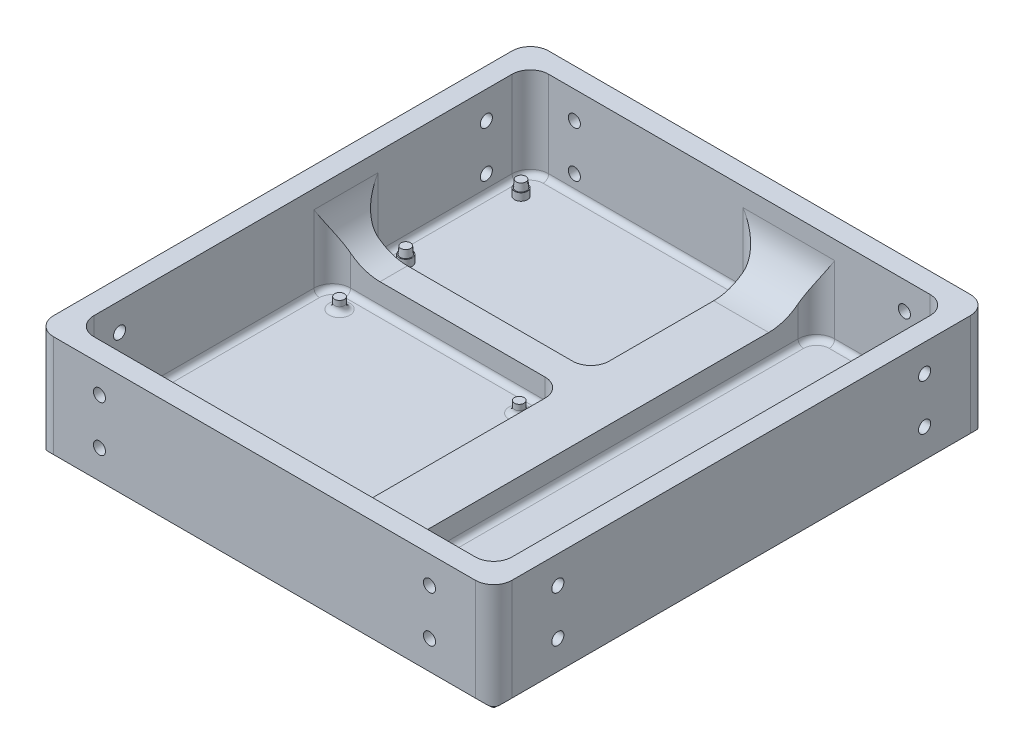
from build123d import *
from OCP.BRepFilletAPI import BRepFilletAPI_MakeChamfer

# Parameters (mm, degrees)
SKETCH1_W                      = 130
SKETCH1_H                      = 140
BOSS_EXTRUDE2_DEPTH            = 10
SKETCH3_R                      = 1.3
BOSS_EXTRUDE4_DEPTH            = 2
SKETCH4_R                      = 1.15
BOSS_EXTRUDE5_DEPTH            = 3
BOSS_EXTRUDE5_DRAFT            = -5
BOSS_EXTRUDE5_PROFILE_2_DEPTH  = 3
BOSS_EXTRUDE5_PROFILE_2_DRAFT  = -5
BOSS_EXTRUDE5_PROFILE_3_DEPTH  = 3
BOSS_EXTRUDE5_PROFILE_3_DRAFT  = -5
BOSS_EXTRUDE5_PROFILE_4_DEPTH  = 3
BOSS_EXTRUDE5_PROFILE_4_DRAFT  = -5
CHAMFER1_SIZE                  = 1.5
CHAMFER1_SIZE2                 = 1.38459352
SKETCH5_W                      = 110
SKETCH5_H                      = 120
BOSS_EXTRUDE6_DEPTH            = 20
SKETCH7_W                      = 114
SKETCH7_H                      = 124
SKETCH7_W_2                    = 110
SKETCH7_H_2                    = 120
CUT_EXTRUDE2_DEPTH             = 20
SKETCH9_W                      = 15
SKETCH9_H                      = 124
BOSS_EXTRUDE8_DEPTH            = 5
SKETCH10_W                     = 63
SKETCH10_H                     = 7.5
BOSS_EXTRUDE9_DEPTH            = 5
SKETCH12_W                     = 63
SKETCH12_H                     = 46.5
SKETCH12_W_2                   = 36
SKETCH12_H_2                   = 124
SKETCH12_H_3                   = 70
SKETCH12_R                     = 1.327872471
SKETCH12_R_2                   = 1.253859906
CUT_EXTRUDE6_DEPTH             = 5
SKETCH14_W                     = 59.963590068
SKETCH14_H                     = 68.475850711
CUT_EXTRUDE9_DEPTH             = 7
SKETCH16_W                     = 114
SKETCH16_H                     = 124
CUT_EXTRUDE10_DEPTH            = 3
FILLET12_R                     = 13
FILLET13_R                     = 5
FILLET14_R                     = 5
FILLET15_R                     = 1.5
SKETCH24_R                     = 1.65
CUT_EXTRUDE16_DEPTH            = 10
CUT_EXTRUDE17_START            = -10
SKETCH25_R                     = 1.65
CUT_EXTRUDE17_DEPTH            = 10
SKETCH26_R                     = 1.65
CUT_EXTRUDE18_DEPTH            = 10
CUT_EXTRUDE19_START            = -10
SKETCH27_R                     = 1.65
CUT_EXTRUDE19_DEPTH            = 10
FILLET17_SIZE                  = 5
SKETCH30_R                     = 1.75
BOSS_EXTRUDE10_DEPTH           = 2
SKETCH31_R                     = 1.5
BOSS_EXTRUDE11_DEPTH           = 2
BOSS_EXTRUDE11_DRAFT           = 5
BOSS_EXTRUDE11_PROFILE_2_DEPTH = 2
BOSS_EXTRUDE11_PROFILE_2_DRAFT = 5
SKETCH32_W                     = 130
SKETCH32_H                     = 140
SKETCH32_W_2                   = 125
SKETCH32_H_2                   = 135
CUT_EXTRUDE22_DEPTH            = 50
FILLET18_R                     = 5


with BuildPart() as part:
    # Sketch1 → Boss-Extrude2 (new body)
    with BuildSketch(Plane(origin=(0, 0, 0), x_dir=(1, 0, 0), z_dir=(0, 1, 0))):
        with Locations((-18.656773153, -29.741986999)):
            Rectangle(SKETCH1_W, SKETCH1_H)
    extrude(amount=BOSS_EXTRUDE2_DEPTH)

    # Sketch3 → Boss-Extrude4 (add)
    with BuildSketch(Plane(origin=(0, 10, 0), x_dir=(1, 0, 0), z_dir=(0, 1, 0))):
        with Locations(Location((-68.656773153, -26.741986999, 0), (0, 0, 270))):
            Circle(SKETCH3_R)
        with Locations(Location((-19.656773153, -26.741986999, 0), (0, 0, 270))):
            Circle(SKETCH3_R)
        with Locations(Location((-68.656773153, -84.741986999, 0), (0, 0, 270))):
            Circle(SKETCH3_R)
        with Locations(Location((-19.656773153, -84.741986999, 0), (0, 0, 270))):
            Circle(SKETCH3_R)
    extrude(amount=BOSS_EXTRUDE4_DEPTH)


with BuildPart() as boss_extrude5_tool:
    # Sketch4 → Boss-Extrude5 (with draft: the straight prism first)
    with BuildSketch(Plane(origin=(0, 12, 0), x_dir=(1, 0, 0), z_dir=(0, 1, 0))):
        with Locations((-68.656773153, -26.741986999)):
            Circle(SKETCH4_R)
    extrude(amount=BOSS_EXTRUDE5_DEPTH)
    # Boss-Extrude5: the draft: its side faces are tilted about the plane it starts from
    boss_extrude5_sides = [boss_extrude5_tool.faces().sort_by_distance(p)[0] for p in [
        (-69.806773153, 13.5, 26.741986999),
    ]]
    draft(boss_extrude5_sides, Plane(origin=(0, 12, 0), x_dir=(1, 0, 0), z_dir=(0, 1, 0)), BOSS_EXTRUDE5_DRAFT)


with BuildPart() as part_1:
    add(part.part)

    # Boss-Extrude5: add boss_extrude5_tool
    add(boss_extrude5_tool.part)


with BuildPart() as boss_extrude5_profile_2_tool:
    # Sketch4 → Boss-Extrude5 profile 2 (with draft: the straight prism first)
    with BuildSketch(Plane(origin=(0, 12, 0), x_dir=(1, 0, 0), z_dir=(0, 1, 0))):
        with Locations((-68.656773153, -84.741986999)):
            Circle(SKETCH4_R)
    extrude(amount=BOSS_EXTRUDE5_PROFILE_2_DEPTH)
    # Boss-Extrude5 profile 2: the draft: its side faces are tilted about the plane it starts from
    boss_extrude5_profile_2_sides = [boss_extrude5_profile_2_tool.faces().sort_by_distance(p)[0] for p in [
        (-69.806773153, 13.5, 84.741986999),
    ]]
    draft(boss_extrude5_profile_2_sides, Plane(origin=(0, 12, 0), x_dir=(1, 0, 0), z_dir=(0, 1, 0)), BOSS_EXTRUDE5_PROFILE_2_DRAFT)


with BuildPart() as part_2:
    add(part_1.part)

    # Boss-Extrude5 profile 2: add boss_extrude5_profile_2_tool
    add(boss_extrude5_profile_2_tool.part)


with BuildPart() as boss_extrude5_profile_3_tool:
    # Sketch4 → Boss-Extrude5 profile 3 (with draft: the straight prism first)
    with BuildSketch(Plane(origin=(0, 12, 0), x_dir=(1, 0, 0), z_dir=(0, 1, 0))):
        with Locations((-19.656773153, -84.741986999)):
            Circle(SKETCH4_R)
    extrude(amount=BOSS_EXTRUDE5_PROFILE_3_DEPTH)
    # Boss-Extrude5 profile 3: the draft: its side faces are tilted about the plane it starts from
    boss_extrude5_profile_3_sides = [boss_extrude5_profile_3_tool.faces().sort_by_distance(p)[0] for p in [
        (-20.806773153, 13.5, 84.741986999),
    ]]
    draft(boss_extrude5_profile_3_sides, Plane(origin=(0, 12, 0), x_dir=(1, 0, 0), z_dir=(0, 1, 0)), BOSS_EXTRUDE5_PROFILE_3_DRAFT)


with BuildPart() as part_3:
    add(part_2.part)

    # Boss-Extrude5 profile 3: add boss_extrude5_profile_3_tool
    add(boss_extrude5_profile_3_tool.part)


with BuildPart() as boss_extrude5_profile_4_tool:
    # Sketch4 → Boss-Extrude5 profile 4 (with draft: the straight prism first)
    with BuildSketch(Plane(origin=(0, 12, 0), x_dir=(1, 0, 0), z_dir=(0, 1, 0))):
        with Locations((-19.656773153, -26.741986999)):
            Circle(SKETCH4_R)
    extrude(amount=BOSS_EXTRUDE5_PROFILE_4_DEPTH)
    # Boss-Extrude5 profile 4: the draft: its side faces are tilted about the plane it starts from
    boss_extrude5_profile_4_sides = [boss_extrude5_profile_4_tool.faces().sort_by_distance(p)[0] for p in [
        (-20.806773153, 13.5, 26.741986999),
    ]]
    draft(boss_extrude5_profile_4_sides, Plane(origin=(0, 12, 0), x_dir=(1, 0, 0), z_dir=(0, 1, 0)), BOSS_EXTRUDE5_PROFILE_4_DRAFT)


with BuildPart() as part_4:
    add(part_3.part)

    # Boss-Extrude5 profile 4: add boss_extrude5_profile_4_tool
    add(boss_extrude5_profile_4_tool.part)

    # Chamfer1: one chamfer whose edges measure the first distance from different faces: ONE call of the kernel's chamfer builder (chamfer() names one face for all edges)
    chamfer1_edges_1 = [part_4.edges().sort_by_distance(p)[0] for p in [
        (-70.069239144, 15, 26.741986999),
    ]]
    chamfer1_side_1 = [part_4.faces().sort_by_distance(p)[0] for p in [
        (-69.938006148, 13.5, 26.741986999),
    ]]
    chamfer1_edges_2 = [part_4.edges().sort_by_distance(p)[0] for p in [
        (-70.069239144, 15, 84.741986999),
    ]]
    chamfer1_side_2 = [part_4.faces().sort_by_distance(p)[0] for p in [
        (-69.938006148, 13.5, 84.741986999),
    ]]
    chamfer1_edges_3 = [part_4.edges().sort_by_distance(p)[0] for p in [
        (-21.069239144, 15, 84.741986999),
    ]]
    chamfer1_side_3 = [part_4.faces().sort_by_distance(p)[0] for p in [
        (-20.938006148, 13.5, 84.741986999),
    ]]
    chamfer1_edges_4 = [part_4.edges().sort_by_distance(p)[0] for p in [
        (-21.069239144, 15, 26.741986999),
    ]]
    chamfer1_side_4 = [part_4.faces().sort_by_distance(p)[0] for p in [
        (-20.938006148, 13.5, 26.741986999),
    ]]
    chamfer1 = BRepFilletAPI_MakeChamfer(part_4.part.solid().wrapped)
    for e in chamfer1_edges_1:
        chamfer1.Add(CHAMFER1_SIZE, CHAMFER1_SIZE2, e.wrapped, chamfer1_side_1[0].wrapped)  # the first distance lies on this face
    for e in chamfer1_edges_2:
        chamfer1.Add(CHAMFER1_SIZE, CHAMFER1_SIZE2, e.wrapped, chamfer1_side_2[0].wrapped)  # the first distance lies on this face
    for e in chamfer1_edges_3:
        chamfer1.Add(CHAMFER1_SIZE, CHAMFER1_SIZE2, e.wrapped, chamfer1_side_3[0].wrapped)  # the first distance lies on this face
    for e in chamfer1_edges_4:
        chamfer1.Add(CHAMFER1_SIZE, CHAMFER1_SIZE2, e.wrapped, chamfer1_side_4[0].wrapped)  # the first distance lies on this face
    add(Compound.cast(chamfer1.Shape()), mode=Mode.REPLACE)

    # Sketch5 → Boss-Extrude6 (add)
    with BuildSketch(Plane(origin=(0, 10, 0), x_dir=(1, 0, 0), z_dir=(0, 1, 0))):
        Polygon((-83.656773153, -89.741986999), (-83.656773153, -99.741986999), (-73.656773153, -99.741986999), (36.343226847, -99.741986999), (46.343226847, -99.741986999), (46.343226847, -89.741986999), (46.343226847, 30.258013001), (46.343226847, 40.258013001), (36.343226847, 40.258013001), (-73.656773153, 40.258013001), (-83.656773153, 40.258013001), (-83.656773153, 30.258013001), align=None)
        with Locations((-18.656773153, -29.741986999)):
            Rectangle(SKETCH5_W, SKETCH5_H, mode=Mode.SUBTRACT)
    extrude(amount=BOSS_EXTRUDE6_DEPTH)

    # Sketch7 → Cut-Extrude2 (cut)
    with BuildSketch(Plane(origin=(0, 30, 0), x_dir=(1, 0, 0), z_dir=(0, 1, 0))):
        with Locations((-18.656773153, -29.741986999)):
            Rectangle(SKETCH7_W, SKETCH7_H)
        with Locations((-18.656773153, -29.741986999)):
            Rectangle(SKETCH7_W_2, SKETCH7_H_2, mode=Mode.SUBTRACT)
    extrude(amount=-CUT_EXTRUDE2_DEPTH, mode=Mode.SUBTRACT)

    # Sketch9 → Boss-Extrude8 (add)
    with BuildSketch(Plane(origin=(0, 10, 0), x_dir=(1, 0, 0), z_dir=(0, 1, 0))):
        with Locations((-5.156773153, -29.741986999)):
            Rectangle(SKETCH9_W, SKETCH9_H)
    extrude(amount=BOSS_EXTRUDE8_DEPTH)

    # Sketch10 → Boss-Extrude9 (add)
    with BuildSketch(Plane(origin=(0, 10, 0), x_dir=(1, 0, 0), z_dir=(0, 1, 0))):
        with Locations((-44.156773153, -17.991986999)):
            Rectangle(SKETCH10_W, SKETCH10_H)
    extrude(amount=BOSS_EXTRUDE9_DEPTH)

    # Sketch12 → Cut-Extrude6 (cut)
    # profile 1 of 3: a face of its own
    with BuildSketch(Plane(origin=(0, 10, 0), x_dir=(1, 0, 0), z_dir=(0, 1, 0))):
        with Locations((-44.156773153, 9.008013001)):
            Rectangle(SKETCH12_W, SKETCH12_H)
    # profile 2 of 3: a face of its own
    with BuildSketch(Plane(origin=(0, 10, 0), x_dir=(1, 0, 0), z_dir=(0, 1, 0))):
        with Locations((20.343226847, -29.741986999)):
            Rectangle(SKETCH12_W_2, SKETCH12_H_2)
    # profile 3 of 3: a face of its own
    with BuildSketch(Plane(origin=(0, 10, 0), x_dir=(1, 0, 0), z_dir=(0, 1, 0))):
        with Locations((-44.156773153, -56.741986999)):
            Rectangle(SKETCH12_W, SKETCH12_H_3)
        with Locations(Location((-68.684645624, -26.741986999, 0), (0, 0, 270))):
            Circle(SKETCH12_R, mode=Mode.SUBTRACT)
        with Locations(Location((-19.656773153, -26.76985947, 0), (0, 0, 270))):
            Circle(SKETCH12_R, mode=Mode.SUBTRACT)
        with Locations(Location((-19.628900682, -84.741986999, 0), (0, 0, 270))):
            Circle(SKETCH12_R_2, mode=Mode.SUBTRACT)
        with Locations(Location((-68.656773153, -84.714114528, 0), (0, 0, 270))):
            Circle(SKETCH12_R_2, mode=Mode.SUBTRACT)
    extrude(amount=-CUT_EXTRUDE6_DEPTH, mode=Mode.SUBTRACT)

    # Sketch14 → Cut-Extrude9 (cut)
    with BuildSketch(Plane(origin=(0, 15, 0), x_dir=(1, 0, 0), z_dir=(0, 1, 0))):
        with Locations((-45.674978119, -55.979912355)):
            Rectangle(SKETCH14_W, SKETCH14_H)
    extrude(amount=-CUT_EXTRUDE9_DEPTH, mode=Mode.SUBTRACT)

    # Sketch16 → Cut-Extrude10 (cut)
    with BuildSketch(Plane(origin=(0, 15, 0), x_dir=(1, 0, 0), z_dir=(0, 1, 0))):
        with Locations((-18.656773153, -29.741986999)):
            Rectangle(SKETCH16_W, SKETCH16_H)
    extrude(amount=-CUT_EXTRUDE10_DEPTH, mode=Mode.SUBTRACT)

    # Fillet12
    fillet12_edges = [part_4.edges().sort_by_distance(p)[0] for p in [
        (-75.656773153, 12, 17.991986999),
        (-5.156773153, 12, -32.258013001),
        (-5.156773153, 12, 91.741986999),
    ]]
    fillet(fillet12_edges, radius=FILLET12_R)

    # Fillet13
    fillet13_edges = [part_4.edges().sort_by_distance(p)[0] for p in [
        (-75.656773153, 15, 21.741986999),
        (-75.656773153, 15, 14.241986999),
        (-12.656773153, 8.5, 21.741986999),
        (-12.656773153, 15, 91.741986999),
        (2.343226847, 15, 91.741986999),
        (2.343226847, 15, -32.258013001),
        (-12.656773153, 8.5, 14.241986999),
        (-12.656773153, 15, -32.258013001),
        (38.343226847, 17.5, 91.741986999),
        (38.343226847, 17.5, -32.258013001),
        (-75.656773153, 17.5, -32.258013001),
        (-75.656773153, 17.5, 91.741986999),
    ]]
    fillet(fillet13_edges, radius=FILLET13_R)

    # Fillet14
    fillet14_edges = [part_4.edges().sort_by_distance(p)[0] for p in [
        (-83.656773153, 15, -40.258013001),
        (46.343226847, 15, -40.258013001),
        (46.343226847, 15, 99.741986999),
        (-83.656773153, 15, 99.741986999),
    ]]
    fillet(fillet14_edges, radius=FILLET14_R)

    # Fillet15
    fillet15_edges = [part_4.edges().sort_by_distance(p)[0] for p in [
        (-68.656773153, 5, 83.460254623),
        (-19.628900682, 5, 83.488127094),
        (-19.656773153, 5, 25.441986999),
        (-68.684645624, 5, 25.414114528),
        (2.343226847, 5, 29.741986999),
        (20.343226847, 5, 91.741986999),
        (38.343226847, 5, 29.741986999),
        (20.343226847, 5, -32.258013001),
        (3.807692941, 5, -30.793546907),
        (36.878760753, 5, 90.277520905),
        (36.878760753, 5, -30.793546907),
        (3.807692941, 5, 90.277520905),
        (-44.156773153, 5, 91.741986999),
        (-44.156773153, 5, 21.741986999),
        (-12.656773153, 5, 56.741986999),
        (-75.656773153, 5, 56.741986999),
        (-14.121239247, 5, 90.277520905),
        (-74.192307059, 5, 90.277520905),
        (-14.121239247, 5, 23.206453093),
        (-74.192307059, 5, 23.206453093),
        (-75.656773153, 5, -9.008013001),
        (-44.156773153, 5, -32.258013001),
        (-44.156773153, 5, 14.241986999),
        (-12.656773153, 5, -9.008013001),
        (-74.192307059, 5, -30.793546907),
        (-14.121239247, 5, -30.793546907),
        (-14.121239247, 5, 12.777520905),
        (-74.192307059, 5, 12.777520905),
    ]]
    fillet(fillet15_edges, radius=FILLET15_R)

    # Sketch24 → Cut-Extrude16 (cut)
    with BuildSketch(Plane(origin=(46.343226847, 0, 0), x_dir=(0, 0, -1), z_dir=(1, 0, 0))):
        with Locations((-79.741986999, 22.5)):
            Circle(SKETCH24_R)
        with Locations((-79.741986999, 10)):
            Circle(SKETCH24_R)
        with Locations((20.258013001, 22.5)):
            Circle(SKETCH24_R)
        with Locations((20.258013001, 10)):
            Circle(SKETCH24_R)
    extrude(amount=-CUT_EXTRUDE16_DEPTH, mode=Mode.SUBTRACT)

    # Sketch25 → Cut-Extrude17 (cut)
    with BuildSketch(Plane.ZY.offset(83.656773153).offset(CUT_EXTRUDE17_START)):
        with Locations(Location((-20.258013001, 22.5, 0), (0, 0, 180))):
            Circle(SKETCH25_R)
        with Locations(Location((-20.258013001, 10, 0), (0, 0, 180))):
            Circle(SKETCH25_R)
        with Locations(Location((79.741986999, 10, 0), (0, 0, 180))):
            Circle(SKETCH25_R)
        with Locations(Location((79.741986999, 22.5, 0), (0, 0, 180))):
            Circle(SKETCH25_R)
    extrude(amount=CUT_EXTRUDE17_DEPTH, mode=Mode.SUBTRACT)

    # Sketch26 → Cut-Extrude18 (cut)
    with BuildSketch(Plane.XY.offset(99.741986999)):
        with Locations((-63.656773153, 22.5)):
            Circle(SKETCH26_R)
        with Locations((-63.656773153, 10)):
            Circle(SKETCH26_R)
        with Locations((26.343226847, 10)):
            Circle(SKETCH26_R)
        with Locations((26.343226847, 22.5)):
            Circle(SKETCH26_R)
    extrude(amount=-CUT_EXTRUDE18_DEPTH, mode=Mode.SUBTRACT)

    # Sketch27 → Cut-Extrude19 (cut)
    with BuildSketch(Plane(origin=(0, 0, -40.258013001), x_dir=(-1, 0, 0), z_dir=(0, 0, -1)).offset(CUT_EXTRUDE19_START)):
        with Locations(Location((-26.343226847, 22.5, 0), (0, 0, 180))):
            Circle(SKETCH27_R)
        with Locations(Location((-26.343226847, 10, 0), (0, 0, 180))):
            Circle(SKETCH27_R)
        with Locations(Location((63.656773153, 22.5, 0), (0, 0, 180))):
            Circle(SKETCH27_R)
        with Locations(Location((63.656773153, 10, 0), (0, 0, 180))):
            Circle(SKETCH27_R)
    extrude(amount=CUT_EXTRUDE19_DEPTH, mode=Mode.SUBTRACT)

    # Fillet17
    # a fillet whose section is not a circle: 5 mm, written as the material it takes off along each edge
    with BuildSketch(Plane(origin=(41.343226847, 0, -35.258013001), x_dir=(1, 0, 0), z_dir=(0, 0, 1))) as fillet17_piece_1:
        with BuildLine():
            Bezier((5, FILLET17_SIZE), (5, 0), (5 - FILLET17_SIZE, 0), weights=[1, 0.070710678, 1])
            Line((5 - FILLET17_SIZE, 0), (5, 0))
            Line((5, 0), (5, FILLET17_SIZE))
        make_face()
    revolve(axis=Axis((41.343226847, 0, -35.258013001), (0, 1, 0)), revolution_arc=90, mode=Mode.SUBTRACT)
    with BuildSketch(Plane(origin=(-78.656773153, 0, -40.258013001), x_dir=(0, 1, 0), z_dir=(1, 0, 0)), Plane(origin=(41.343226847, 0, 99.741986999), x_dir=(0, 1, 0), z_dir=(-1, 0, 0))) as fillet17_piece_2:
        with BuildLine():
            Bezier((FILLET17_SIZE, 0), (0, 0), (0, FILLET17_SIZE), weights=[1, 0.070710678, 1])
            Line((0, FILLET17_SIZE), (0, 0))
            Line((0, 0), (FILLET17_SIZE, 0))
        make_face()
    extrude(amount=120, mode=Mode.SUBTRACT)
    with BuildSketch(Plane(origin=(-78.656773153, 0, -35.258013001), x_dir=(0, 0, -1), z_dir=(1, 0, 0))) as fillet17_piece_3:
        with BuildLine():
            Bezier((5, FILLET17_SIZE), (5, 0), (5 - FILLET17_SIZE, 0), weights=[1, 0.070710678, 1])
            Line((5 - FILLET17_SIZE, 0), (5, 0))
            Line((5, 0), (5, FILLET17_SIZE))
        make_face()
    revolve(axis=Axis((-78.656773153, 0, -35.258013001), (0, 1, 0)), revolution_arc=90, mode=Mode.SUBTRACT)
    with BuildSketch(Plane(origin=(-83.656773153, 0, 94.741986999), x_dir=(0, 1, 0), z_dir=(0, 0, -1)), Plane(origin=(46.343226847, 0, -35.258013001), x_dir=(0, 1, 0), z_dir=(0, 0, 1))) as fillet17_piece_4:
        with BuildLine():
            Bezier((FILLET17_SIZE, 0), (0, 0), (0, FILLET17_SIZE), weights=[1, 0.070710678, 1])
            Line((0, FILLET17_SIZE), (0, 0))
            Line((0, 0), (FILLET17_SIZE, 0))
        make_face()
    extrude(amount=130, mode=Mode.SUBTRACT)
    with BuildSketch(Plane(origin=(-78.656773153, 0, 94.741986999), x_dir=(0, 0, 1), z_dir=(1, 0, 0))) as fillet17_piece_5:
        with BuildLine():
            Bezier((5, -FILLET17_SIZE), (5, 0), (5 - FILLET17_SIZE, 0), weights=[1, 0.070710678, 1])
            Line((5 - FILLET17_SIZE, 0), (5, 0))
            Line((5, 0), (5, -FILLET17_SIZE))
        make_face()
    revolve(axis=Axis((-78.656773153, 0, 94.741986999), (0, -1, 0)), revolution_arc=90, mode=Mode.SUBTRACT)
    with BuildSketch(Plane(origin=(41.343226847, 0, 94.741986999), x_dir=(1, 0, 0), z_dir=(0, 0, -1))) as fillet17_piece_6:
        with BuildLine():
            Bezier((5, -FILLET17_SIZE), (5, 0), (5 - FILLET17_SIZE, 0), weights=[1, 0.070710678, 1])
            Line((5 - FILLET17_SIZE, 0), (5, 0))
            Line((5, 0), (5, -FILLET17_SIZE))
        make_face()
    revolve(axis=Axis((41.343226847, 0, 94.741986999), (0, -1, 0)), revolution_arc=90, mode=Mode.SUBTRACT)

    # Sketch30 → Boss-Extrude10 (add)
    with BuildSketch(Plane(origin=(0, 5, 0), x_dir=(1, 0, 0), z_dir=(0, 1, 0))):
        with Locations(Location((-70.656773153, 24.723013001, 0), (0, 0, 270))):
            Circle(SKETCH30_R)
        with Locations(Location((-70.656773153, -6.706986999, 0), (0, 0, 270))):
            Circle(SKETCH30_R)
    extrude(amount=BOSS_EXTRUDE10_DEPTH)


with BuildPart() as boss_extrude11_tool:
    # Sketch31 → Boss-Extrude11 (with draft: the straight prism first)
    with BuildSketch(Plane(origin=(0, 7, 0), x_dir=(1, 0, 0), z_dir=(0, 1, 0))):
        with Locations((-70.656773153, 24.723013001)):
            Circle(SKETCH31_R)
    extrude(amount=BOSS_EXTRUDE11_DEPTH)
    # Boss-Extrude11: the draft: its side faces are tilted about the plane it starts from
    boss_extrude11_sides = [boss_extrude11_tool.faces().sort_by_distance(p)[0] for p in [
        (-72.156773153, 8, -24.723013001),
    ]]
    draft(boss_extrude11_sides, Plane(origin=(0, 7, 0), x_dir=(1, 0, 0), z_dir=(0, 1, 0)), BOSS_EXTRUDE11_DRAFT)


with BuildPart() as part_5:
    add(part_4.part)

    # Boss-Extrude11: add boss_extrude11_tool
    add(boss_extrude11_tool.part)


with BuildPart() as boss_extrude11_profile_2_tool:
    # Sketch31 → Boss-Extrude11 profile 2 (with draft: the straight prism first)
    with BuildSketch(Plane(origin=(0, 7, 0), x_dir=(1, 0, 0), z_dir=(0, 1, 0))):
        with Locations((-70.656773153, -6.706986999)):
            Circle(SKETCH31_R)
    extrude(amount=BOSS_EXTRUDE11_PROFILE_2_DEPTH)
    # Boss-Extrude11 profile 2: the draft: its side faces are tilted about the plane it starts from
    boss_extrude11_profile_2_sides = [boss_extrude11_profile_2_tool.faces().sort_by_distance(p)[0] for p in [
        (-72.156773153, 8, 6.706986999),
    ]]
    draft(boss_extrude11_profile_2_sides, Plane(origin=(0, 7, 0), x_dir=(1, 0, 0), z_dir=(0, 1, 0)), BOSS_EXTRUDE11_PROFILE_2_DRAFT)


with BuildPart() as part_6:
    add(part_5.part)

    # Boss-Extrude11 profile 2: add boss_extrude11_profile_2_tool
    add(boss_extrude11_profile_2_tool.part)

    # Sketch32 → Cut-Extrude22 (cut)
    with BuildSketch(Plane(origin=(0, 30, 0), x_dir=(1, 0, 0), z_dir=(0, 1, 0))):
        with Locations((-18.656773153, -29.741986999)):
            Rectangle(SKETCH32_W, SKETCH32_H)
        with Locations((-18.656773153, -29.741986999)):
            Rectangle(SKETCH32_W_2, SKETCH32_H_2, mode=Mode.SUBTRACT)
    extrude(amount=-CUT_EXTRUDE22_DEPTH, mode=Mode.SUBTRACT)

    # Fillet18
    fillet18_edges = [part_6.edges().sort_by_distance(p)[0] for p in [
        (-81.156773153, 16.61402419, 97.241986999),
        (43.843226847, 16.61402419, -37.758013001),
        (-81.156773153, 16.61402419, -37.758013001),
        (43.843226847, 16.61402419, 97.241986999),
    ]]
    fillet(fillet18_edges, radius=FILLET18_R)


solid = part_6.part
